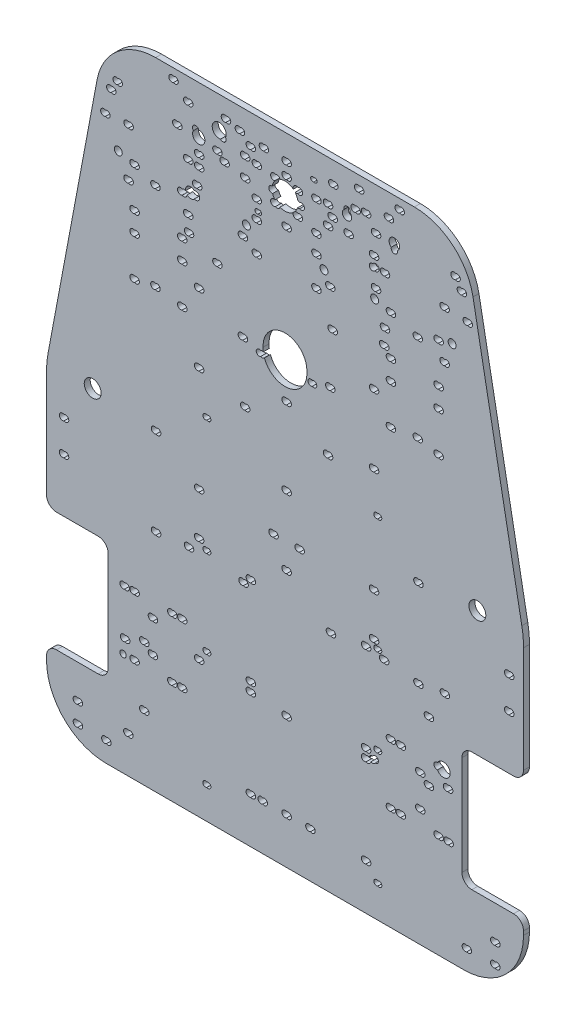
from build123d import *

# Parameters (mm, degrees)
F_3MM_DEPTH           = 3
SKETCH_2_R            = 1.6
SKETCH_2_R_2          = 4
SKETCH_2_R_3          = 1.1
SKETCH_2_R_4          = 1.35
SKETCH_2_R_5          = 4.25
SKETCH_2_R_6          = 11
SKETCH_2_R_7          = 2
SKETCH_2_R_8          = 1.5
CUT_EXTRUDE_3_DEPTH   = 201.022499011
SKETCH_741_R          = 1.6
SKETCH_741_R_2        = 1.711427977
CUT_EXTRUDE_741_DEPTH = 201.022499011
SKETCH_742_R          = 1.6
SKETCH_742_R_2        = 2.352104549
CUT_EXTRUDE_742_DEPTH = 201.022499011
SKETCH_744_R          = 1.6
SKETCH_744_R_2        = 2.649002075
CUT_EXTRUDE_744_DEPTH = 201.022499011
SKETCH_745_R          = 1.6
SKETCH_745_R_2        = 6.568410147
CUT_EXTRUDE_745_DEPTH = 201.022499011
SKETCH_746_R          = 1.6
SKETCH_746_R_2        = 1.1
SKETCH_746_R_3        = 3.518942956
SKETCH_746_R_4        = 1.35
SKETCH_746_R_5        = 3.094707093
CUT_EXTRUDE_746_DEPTH = 201.022499011
SKETCH_747_R          = 1.6
SKETCH_747_R_2        = 1.35
SKETCH_747_R_3        = 4.25
CUT_EXTRUDE_747_DEPTH = 201.022499011
SKETCH_748_R          = 4.25
SKETCH_748_R_2        = 1.6
SKETCH_748_R_3        = 3.400087717
SKETCH_748_R_4        = 1.35
CUT_EXTRUDE_748_DEPTH = 201.022499011
SKETCH_749_R          = 1.6
CUT_EXTRUDE_749_DEPTH = 201.022499011
SKETCH_750_R          = 1.6
SKETCH_750_R_2        = 11
CUT_EXTRUDE_750_DEPTH = 201.022499011
SKETCH_751_R          = 1.6
SKETCH_751_R_2        = 2.600019391
SKETCH_751_R_3        = 1.5
SKETCH_751_R_4        = 0.000364137
CUT_EXTRUDE_751_DEPTH = 201.022499011
SKETCH_752_R          = 1.6
SKETCH_752_R_2        = 1.5
CUT_EXTRUDE_752_DEPTH = 201.022499011


with BuildPart() as part:
    # 草图1 → 底盘板_3mm (new body)
    with BuildSketch(Plane.XY):
        with BuildLine():
            Line((-120, -4.645), (-120, -58.035))
            ThreePointArc((-120, -58.035), (-118.535533906, -61.570533906), (-115, -63.035))
            Line((-115, -63.035), (-94, -63.035))
            ThreePointArc((-94, -63.035), (-90.464466094, -64.499466094), (-89, -68.035))
            Line((-89, -68.035), (-89, -118.035))
            ThreePointArc((-89, -118.035), (-90.464466094, -121.570533906), (-94, -123.035))
            Line((-94, -123.035), (-115, -123.035))
            ThreePointArc((-115, -123.035), (-118.535533906, -124.499466094), (-120, -128.035))
            Line((-120, -128.035), (-120, -130))
            ThreePointArc((-120, -130), (-111.213203436, -151.213203436), (-90, -160))
            Line((-90, -160), (90, -160))
            ThreePointArc((90, -160), (111.213203436, -151.213203436), (120, -130))
            Line((120, -130), (120, -128.035))
            ThreePointArc((120, -128.035), (118.535533906, -124.499466094), (115, -123.035))
            Line((115, -123.035), (94, -123.035))
            ThreePointArc((94, -123.035), (90.464466094, -121.570533906), (89, -118.035))
            Line((89, -118.035), (89, -68.035))
            ThreePointArc((89, -68.035), (90.464466094, -64.499466094), (94, -63.035))
            Line((94, -63.035), (115, -63.035))
            ThreePointArc((115, -63.035), (118.535533906, -61.570533906), (120, -58.035))
            Line((120, -58.035), (120, -4.645))
            ThreePointArc((120, -4.645), (119.785929551, -0.020186507), (119.145, 4.565))
            Line((119.145, 4.565), (94.59, 135.53))
            ThreePointArc((94.59, 135.53), (84.261063156, 153.087014813), (65.1, 160))
            Line((65.1, 160), (-65.1, 160))
            ThreePointArc((-65.1, 160), (-84.261063156, 153.087014813), (-94.59, 135.53))
            Line((-94.59, 135.53), (-119.145, 4.565))
            ThreePointArc((-119.145, 4.565), (-119.785929551, -0.020186507), (-120, -4.645))
        make_face()
    extrude(amount=F_3MM_DEPTH)

    # 草图2 → 切除-拉伸3 (cut, through all)
    with BuildSketch(Plane.XY):
        with Locations((71.622234231, -88.447031965)):
            Circle(SKETCH_2_R)
        with Locations((71.622234231, -58.447031965)):
            Circle(SKETCH_2_R)
        with Locations((-18, -88.049953604)):
            Circle(SKETCH_2_R)
        with Locations((79.5, 99.850046396)):
            Circle(SKETCH_2_R)
        with Locations((-44, -38.557395553)):
            Circle(SKETCH_2_R)
        with Locations((-44, -91.357395553)):
            Circle(SKETCH_2_R)
        with Locations((-18, -43.549953604)):
            Circle(SKETCH_2_R)
        with Locations((-81.250002615, -100.899956178)):
            Circle(SKETCH_2_R)
        with Locations((49.5, 99.850046396)):
            Circle(SKETCH_2_R)
        with Locations((-15, 99.850051162)):
            Circle(SKETCH_2_R)
        with Locations((44, -38.557395553)):
            Circle(SKETCH_2_R)
        with Locations((-18, -137.049953604)):
            Circle(SKETCH_2_R)
        with Locations((79.622234231, -44.447031965)):
            Circle(SKETCH_2_R)
        with Locations((79.5, 123.850046396)):
            Circle(SKETCH_2_R)
        with Locations((-44, 70.442604447)):
            Circle(SKETCH_2_R)
        with Locations((-44, -17.057395553)):
            Circle(SKETCH_2_R)
        with Locations((-15, 123.850051162)):
            Circle(SKETCH_2_R)
        with Locations((44, 123.242604447)):
            Circle(SKETCH_2_R)
        with Locations((5.656854249, 137.85315184)):
            Circle(SKETCH_2_R)
        with Locations((40, -92.549953604)):
            Circle(SKETCH_2_R)
        with Locations((-18, -92.549953604)):
            Circle(SKETCH_2_R)
        with Locations((44, -17.057395553)):
            Circle(SKETCH_2_R)
        with Locations((49.5, 123.850046396)):
            Circle(SKETCH_2_R)
        with Locations((40, 145.200046396)):
            Circle(SKETCH_2_R)
        with Locations((44, -91.357395553)):
            Circle(SKETCH_2_R)
        with Locations((40, -88.049953604)):
            Circle(SKETCH_2_R)
        with Locations((-5.656854249, 137.85315184)):
            Circle(SKETCH_2_R)
        with Locations((31.2, 141.805256388)):
            Circle(SKETCH_2_R)
        with Locations((44, 35.742604447)):
            Circle(SKETCH_2_R)
        with Locations((-79.5, 99.850051162)):
            Circle(SKETCH_2_R)
        with Locations((15, 138.850046396)):
            Circle(SKETCH_2_R)
        with Locations((-6.553216354, 131.749791971)):
            Circle(SKETCH_2_R)
        with Locations((-79.622234231, -141.352878604)):
            Circle(SKETCH_2_R)
        with Locations((36.5, 153.850046396)):
            Circle(SKETCH_2_R)
        with Locations((40, -137.049953604)):
            Circle(SKETCH_2_R)
        with Locations((44, 70.442604447)):
            Circle(SKETCH_2_R)
        with Locations((-5.656854249, 126.539443341)):
            Circle(SKETCH_2_R)
        with Locations((15, 123.850046396)):
            Circle(SKETCH_2_R)
        with Locations((-18, 145.200046396)):
            Circle(SKETCH_2_R)
        with Locations((-23.5, 149.418399051)):
            Circle(SKETCH_2_R)
        with Locations((5.656854249, 126.539443341)):
            Circle(SKETCH_2_R)
        with Locations((45, 138.850046396)):
            Circle(SKETCH_2_R)
        with Locations((-79.5, 123.850051162)):
            Circle(SKETCH_2_R)
        with Locations((15, 99.850046396)):
            Circle(SKETCH_2_R)
        with Locations((40, -43.549953604)):
            Circle(SKETCH_2_R)
        with Locations((-15, 138.850046396)):
            Circle(SKETCH_2_R)
        with Locations((6.553216354, 131.749791971)):
            Circle(SKETCH_2_R)
        with Locations((-71.622234231, -127.352878604)):
            Circle(SKETCH_2_R)
        with Locations((-71.622234231, -97.352878604)):
            Circle(SKETCH_2_R)
        with Locations((55, 136.201044321)):
            Circle(SKETCH_2_R)
        with Locations((81.250001797, -84.899956178)):
            Circle(SKETCH_2_R)
        with Locations((-49.5, 148.850046396)):
            Circle(SKETCH_2_R)
        with Locations((-30.5, 150.850046396)):
            Circle(SKETCH_2_R)
        with Locations((-44, 123.242604447)):
            Circle(SKETCH_2_R)
        with Locations((15, 114.850046396)):
            Circle(SKETCH_2_R)
        with Locations((0, 132.19629759)):
            Circle(SKETCH_2_R_2)
        with Locations((-20.859650045, 130.055947635)):
            Circle(SKETCH_2_R)
        with Locations((0, 119.16118048)):
            Circle(SKETCH_2_R)
        with Locations((23.5, 149.418399051)):
            Circle(SKETCH_2_R)
        with Locations((-44, 35.742604447)):
            Circle(SKETCH_2_R)
        with Locations((31.2, 131.805756351)):
            Circle(SKETCH_2_R)
        with Locations((51.5, 148.850046396)):
            Circle(SKETCH_2_R)
        with Locations((-14, 118.569502671)):
            Circle(SKETCH_2_R_3)
        with Locations((20.859650045, 130.055947635)):
            Circle(SKETCH_2_R)
        with Locations((-34.718942956, 144.239249799)):
            Circle(SKETCH_2_R)
        with Locations((-49.5, 123.850051162)):
            Circle(SKETCH_2_R)
        with Locations((45, 114.850046396)):
            Circle(SKETCH_2_R)
        with Locations((-55, 136.201044321)):
            Circle(SKETCH_2_R)
        with Locations((-45, 114.850046396)):
            Circle(SKETCH_2_R)
        with Locations((14.001428535, 146.570931206)):
            Circle(SKETCH_2_R_3)
        with Locations((0.000714267, 147.570216938)):
            Circle(SKETCH_2_R)
        with Locations((-31.2, 141.805256388)):
            Circle(SKETCH_2_R)
        with Locations((34.718942956, 144.239249799)):
            Circle(SKETCH_2_R)
        with Locations((44, 128.742604447)):
            Circle(SKETCH_2_R)
        with Locations((-11.4, 147.950874114)):
            Circle(SKETCH_2_R)
        with Locations((-20.859650045, 139.555947635)):
            Circle(SKETCH_2_R)
        with Locations((46, -85.981658309)):
            Circle(SKETCH_2_R_4)
        with Locations((105, -140)):
            Circle(SKETCH_2_R)
        with Locations((-15, 114.850046396)):
            Circle(SKETCH_2_R)
        with Locations((-45, 138.850046396)):
            Circle(SKETCH_2_R)
        with Locations((20.859650045, 139.555947635)):
            Circle(SKETCH_2_R)
        with Locations((-31.2, 131.805756351)):
            Circle(SKETCH_2_R)
        with Locations((-40, -85.981658309)):
            Circle(SKETCH_2_R_4)
        with Locations((-85, 140)):
            Circle(SKETCH_2_R)
        with Locations((85, 140)):
            Circle(SKETCH_2_R)
        with Locations((-40, -143.981658309)):
            Circle(SKETCH_2_R_4)
        with Locations((46, 16.018341691)):
            Circle(SKETCH_2_R_4)
        with Locations((46, -143.981658309)):
            Circle(SKETCH_2_R_4)
        with Locations((-105, -140)):
            Circle(SKETCH_2_R)
        with Locations((96.780235291, 0)):
            Circle(SKETCH_2_R_5)
        with Locations((46, -41.981658309)):
            Circle(SKETCH_2_R_4)
        with Locations((-81.500257083, -78.034400889)):
            Circle(SKETCH_2_R)
        with Locations((-57.500257083, -78.034265396)):
            Circle(SKETCH_2_R)
        with Locations((52.5, -77.899953594)):
            Circle(SKETCH_2_R)
        with Locations((-76.5, -107.899953594)):
            Circle(SKETCH_2_R)
        with Locations((-40, -41.981658309)):
            Circle(SKETCH_2_R_4)
        with Locations((-52.5, -107.899953594)):
            Circle(SKETCH_2_R)
        with Locations((-81.500087717, -108.034400888)):
            Circle(SKETCH_2_R)
        with Locations((57.500087718, -108.034265395)):
            Circle(SKETCH_2_R)
        with Locations((67.250001797, -84.899956894)):
            Circle(SKETCH_2_R)
        with Locations((-96.780235291, 0)):
            Circle(SKETCH_2_R_5)
        with Locations((-52.5, -77.899953594)):
            Circle(SKETCH_2_R)
        with Locations((-76.5, -77.899953594)):
            Circle(SKETCH_2_R)
        with Locations((81.500087717, -108.034400888)):
            Circle(SKETCH_2_R)
        with Locations((67.250002615, -100.899956894)):
            Circle(SKETCH_2_R)
        with Locations((76.5, -77.899953594)):
            Circle(SKETCH_2_R)
        with Locations((81.500257083, -78.034400889)):
            Circle(SKETCH_2_R)
        with Locations((12, -137.015533447)):
            Circle(SKETCH_2_R)
        with Locations((-67.250001797, -84.899956894)):
            Circle(SKETCH_2_R)
        with Locations((-57.500087718, -108.034265395)):
            Circle(SKETCH_2_R)
        with Locations((-40, 16.018341691)):
            Circle(SKETCH_2_R_4)
        with Locations((112, -36.049427032)):
            Circle(SKETCH_2_R)
        with Locations((-90.691009521, -150)):
            Circle(SKETCH_2_R)
        with Locations((105, -150)):
            Circle(SKETCH_2_R)
        with Locations((112, -19.970226288)):
            Circle(SKETCH_2_R)
        with Locations((-67.250002615, -100.899956894)):
            Circle(SKETCH_2_R)
        with Locations((0, -137.015533447)):
            Circle(SKETCH_2_R)
        with Locations((-105, -150)):
            Circle(SKETCH_2_R)
        with Locations((91.157012939, 123.126899719)):
            Circle(SKETCH_2_R)
        with Locations((-112, -36.049427032)):
            Circle(SKETCH_2_R)
        with Locations((22, 60.203447413)):
            Circle(SKETCH_2_R)
        with Locations((76.5, -107.899953594)):
            Circle(SKETCH_2_R)
        with Locations((23.201995778, 134.920523381)):
            Circle(SKETCH_2_R)
        with Locations((-112, -19.970226288)):
            Circle(SKETCH_2_R)
        with Locations((56.9, 155)):
            Circle(SKETCH_2_R)
        with Locations((-91.157012939, 123.126899719)):
            Circle(SKETCH_2_R)
        with Locations((66.328412861, -46.618020535)):
            Circle(SKETCH_2_R)
        with Locations((90.691009521, -150)):
            Circle(SKETCH_2_R)
        with Locations((-65.671587139, -46.618020535)):
            Circle(SKETCH_2_R)
        with Locations((-66, 60.203447413)):
            Circle(SKETCH_2_R)
        with Locations((-56.9, 155)):
            Circle(SKETCH_2_R)
        with Locations((88.2, 134.984603882)):
            Circle(SKETCH_2_R)
        with Locations((-22, 60.203447413)):
            Circle(SKETCH_2_R)
        with Locations((66.328412861, -2.618020535)):
            Circle(SKETCH_2_R)
        with Locations((57.500257083, -78.034265396)):
            Circle(SKETCH_2_R)
        with Locations((23.201995778, 85.920523381)):
            Circle(SKETCH_2_R)
        with Locations((-88.2, 134.984603882)):
            Circle(SKETCH_2_R)
        with Locations((22, 104.203447413)):
            Circle(SKETCH_2_R)
        with Locations((52.5, 108.100046406)):
            Circle(SKETCH_2_R)
        with Locations((76.5, 58.100046406)):
            Circle(SKETCH_2_R)
        with Locations((-66, 104.203447413)):
            Circle(SKETCH_2_R)
        with Locations((66, 60.203447413)):
            Circle(SKETCH_2_R)
        with Locations((-76.5, 108.100046406)):
            Circle(SKETCH_2_R)
        with Locations((52.5, 78.100046406)):
            Circle(SKETCH_2_R)
        with Locations((76.5, 78.100046406)):
            Circle(SKETCH_2_R)
        with Locations((-12, -137.015533447)):
            Circle(SKETCH_2_R)
        with Locations((-76.5, 88.100046406)):
            Circle(SKETCH_2_R)
        with Locations((76.5, 88.100046406)):
            Circle(SKETCH_2_R)
        with Locations((-76.5, 58.100046406)):
            Circle(SKETCH_2_R)
        with Locations((-34.798004222, 85.920523381)):
            Circle(SKETCH_2_R)
        with Locations((52.5, -107.899953594)):
            Circle(SKETCH_2_R)
        with Locations((76.5, 108.100046406)):
            Circle(SKETCH_2_R)
        with Locations((-52.5, 88.100046406)):
            Circle(SKETCH_2_R)
        with Locations((49.100000001, 92.072292328)):
            Circle(SKETCH_2_R)
        with Locations((-52.5, 58.100046406)):
            Circle(SKETCH_2_R)
        with Locations((-65.671587139, -2.618020535)):
            Circle(SKETCH_2_R)
        with Locations((-52.5, 78.100046406)):
            Circle(SKETCH_2_R)
        with Locations((0, 61.572292328)):
            Circle(SKETCH_2_R_6)
        with Locations((66, 104.203447413)):
            Circle(SKETCH_2_R)
        with Locations((-52.5, 108.100046406)):
            Circle(SKETCH_2_R)
        with Locations((-83.899680603, 109.91658817)):
            Circle(SKETCH_2_R_7)
        with Locations((-76.5, 78.100046406)):
            Circle(SKETCH_2_R)
        with Locations((-49.100000003, 92.072292326)):
            Circle(SKETCH_2_R)
        with Locations((-20.859650045, 30.236647545)):
            Circle(SKETCH_2_R)
        with Locations((6.553216354, -17.950208029)):
            Circle(SKETCH_2_R)
        with Locations((52.5, 88.100046406)):
            Circle(SKETCH_2_R)
        with Locations((-22, 104.203447413)):
            Circle(SKETCH_2_R)
        with Locations((-44.899980612, 109.916808344)):
            Circle(SKETCH_2_R_7)
        with Locations((1e-09, -94.027707672)):
            Circle(SKETCH_2_R)
        with Locations((-34.798004222, 134.920523381)):
            Circle(SKETCH_2_R)
        with Locations((12.991095324, 57.47014817)):
            Circle(SKETCH_2_R_8)
        with Locations((19.600159387, 109.917172481)):
            Circle(SKETCH_2_R_7)
        with Locations((20.859650045, 30.236647545)):
            Circle(SKETCH_2_R)
        with Locations((-6.553216354, -17.950208029)):
            Circle(SKETCH_2_R)
        with Locations((-3e-09, 4.172292326)):
            Circle(SKETCH_2_R)
        with Locations((1e-09, 42.972292328)):
            Circle(SKETCH_2_R)
        with Locations((0, -30.53881952)):
            Circle(SKETCH_2_R)
        with Locations((-44, 128.742604447)):
            Circle(SKETCH_2_R)
        with Locations((-49.5, 99.850051162)):
            Circle(SKETCH_2_R)
        with Locations((-21.671587139, -46.618020535)):
            Circle(SKETCH_2_R)
        with Locations((-3e-09, 141.172292326)):
            Circle(SKETCH_2_R)
        with Locations((-49.100000003, -44.927707674)):
            Circle(SKETCH_2_R)
        with Locations((52.5, 58.100046406)):
            Circle(SKETCH_2_R)
        with Locations((45.100239394, 109.917316443)):
            Circle(SKETCH_2_R_7)
        with Locations((-12.989666789, 57.470216938)):
            Circle(SKETCH_2_R_8)
        with Locations((84.099939386, 109.917536617)):
            Circle(SKETCH_2_R_7)
        with Locations((22.328412861, -46.618020535)):
            Circle(SKETCH_2_R)
        with Locations((49.100000001, -44.927707672)):
            Circle(SKETCH_2_R)
        with Locations((-19.399540604, 109.916952308)):
            Circle(SKETCH_2_R_7)
    extrude(amount=CUT_EXTRUDE_3_DEPTH, mode=Mode.SUBTRACT)

    # 草图741 → 切除-拉伸741 (cut, through all)
    with BuildSketch(Plane.XY):
        with Locations((73.222234231, -88.447031965)):
            Circle(SKETCH_741_R)
        with Locations((73.222234231, -58.447031965)):
            Circle(SKETCH_741_R)
        with Locations((-16.4, -88.049953604)):
            Circle(SKETCH_741_R)
        with Locations((81.1, 99.850046396)):
            Circle(SKETCH_741_R)
        with Locations((-42.4, -38.557395553)):
            Circle(SKETCH_741_R)
        with Locations((-42.4, -91.357395553)):
            Circle(SKETCH_741_R)
        with Locations((-16.4, -43.549953604)):
            Circle(SKETCH_741_R)
        with Locations((-79.650002615, -100.899956178)):
            Circle(SKETCH_741_R)
        with Locations((51.1, 99.850046396)):
            Circle(SKETCH_741_R)
        with Locations((-13.4, 99.850051162)):
            Circle(SKETCH_741_R)
        with Locations((45.6, -38.557395553)):
            Circle(SKETCH_741_R)
        with Locations((-16.4, -137.049953604)):
            Circle(SKETCH_741_R)
        with Locations((81.222234231, -44.447031965)):
            Circle(SKETCH_741_R)
        with Locations((81.1, 123.850046396)):
            Circle(SKETCH_741_R)
        with Locations((-42.4, 70.442604447)):
            Circle(SKETCH_741_R)
        with Locations((-42.4, -17.057395553)):
            Circle(SKETCH_741_R)
        with Locations((-13.4, 123.850051162)):
            Circle(SKETCH_741_R)
        with Locations((45.6, 123.850046396)):
            Circle(SKETCH_741_R_2)
        with Locations((7.256854249, 137.85315184)):
            Circle(SKETCH_741_R)
        with Locations((41.6, -92.549953604)):
            Circle(SKETCH_741_R)
    extrude(amount=CUT_EXTRUDE_741_DEPTH, mode=Mode.SUBTRACT)

    # 草图742 → 切除-拉伸742 (cut, through all)
    with BuildSketch(Plane.XY):
        with Locations((-16.4, -92.549953604)):
            Circle(SKETCH_742_R)
        with Locations((45.6, -17.057395553)):
            Circle(SKETCH_742_R)
        with Locations((51.1, 123.850046396)):
            Circle(SKETCH_742_R)
        with Locations((41.6, 145.200046396)):
            Circle(SKETCH_742_R)
        with Locations((45.432856299, -90.645410422)):
            Circle(SKETCH_742_R)
        with Locations((41.6, -88.049953604)):
            Circle(SKETCH_742_R)
        with Locations((-4.056854249, 137.85315184)):
            Circle(SKETCH_742_R)
        with Locations((31.2, 139.45315184)):
            Circle(SKETCH_742_R_2)
        with Locations((45.6, 35.742604447)):
            Circle(SKETCH_742_R)
        with Locations((-77.9, 99.850051162)):
            Circle(SKETCH_742_R)
        with Locations((16.6, 138.850046396)):
            Circle(SKETCH_742_R)
        with Locations((-4.953216354, 131.749791971)):
            Circle(SKETCH_742_R)
        with Locations((-78.022234231, -141.352878604)):
            Circle(SKETCH_742_R)
        with Locations((38.1, 153.850046396)):
            Circle(SKETCH_742_R)
        with Locations((41.6, -137.049953604)):
            Circle(SKETCH_742_R)
        with Locations((45.6, 70.442604447)):
            Circle(SKETCH_742_R)
        with Locations((-4.056854249, 126.539443341)):
            Circle(SKETCH_742_R)
        with Locations((16.6, 123.850046396)):
            Circle(SKETCH_742_R)
        with Locations((-16.4, 145.200046396)):
            Circle(SKETCH_742_R)
        with Locations((-21.9, 149.418399051)):
            Circle(SKETCH_742_R)
    extrude(amount=CUT_EXTRUDE_742_DEPTH, mode=Mode.SUBTRACT)

    # 草图744 → 切除-拉伸744 (cut, through all)
    with BuildSketch(Plane.XY):
        with Locations((7.256854249, 126.539443341)):
            Circle(SKETCH_744_R)
        with Locations((46.6, 138.850046396)):
            Circle(SKETCH_744_R)
        with Locations((-77.9, 123.850051162)):
            Circle(SKETCH_744_R)
        with Locations((16.6, 99.850046396)):
            Circle(SKETCH_744_R)
        with Locations((41.6, -43.549953604)):
            Circle(SKETCH_744_R)
        with Locations((-13.4, 138.850046396)):
            Circle(SKETCH_744_R)
        with Locations((8.153216354, 131.749791971)):
            Circle(SKETCH_744_R)
        with Locations((-70.022234231, -127.352878604)):
            Circle(SKETCH_744_R)
        with Locations((-70.022234231, -97.352878604)):
            Circle(SKETCH_744_R)
        with Locations((55, 138.850046396)):
            Circle(SKETCH_744_R_2)
    extrude(amount=CUT_EXTRUDE_744_DEPTH, mode=Mode.SUBTRACT)

    # 草图745 → 切除-拉伸745 (cut, through all)
    with BuildSketch(Plane.XY):
        with Locations((82.850001797, -84.899956178)):
            Circle(SKETCH_745_R)
        with Locations((-47.9, 148.850046396)):
            Circle(SKETCH_745_R)
        with Locations((-28.9, 150.850046396)):
            Circle(SKETCH_745_R)
        with Locations((-42.4, 123.242604447)):
            Circle(SKETCH_745_R)
        with Locations((16.6, 114.850046396)):
            Circle(SKETCH_745_R)
        with Locations((0, 132.19629759)):
            Circle(SKETCH_745_R_2)
        with Locations((-19.259650045, 130.055947635)):
            Circle(SKETCH_745_R)
        with Locations((1.6, 119.16118048)):
            Circle(SKETCH_745_R)
        with Locations((25.1, 149.418399051)):
            Circle(SKETCH_745_R)
        with Locations((-42.4, 35.742604447)):
            Circle(SKETCH_745_R)
    extrude(amount=CUT_EXTRUDE_745_DEPTH, mode=Mode.SUBTRACT)

    # 草图746 → 切除-拉伸746 (cut, through all)
    # profile 1 of 19: a face of its own
    with BuildSketch(Plane.XY):
        with Locations((32.8, 131.805756351)):
            Circle(SKETCH_746_R)
    # profile 2 of 19: a face of its own
    with BuildSketch(Plane.XY):
        with Locations((53.1, 148.850046396)):
            Circle(SKETCH_746_R)
    # profile 3 of 19: a face of its own
    with BuildSketch(Plane.XY):
        with Locations((-12.9, 118.569502671)):
            Circle(SKETCH_746_R_2)
    # profile 4 of 19: a face of its own
    with BuildSketch(Plane.XY):
        with Locations((22.459650045, 130.055947635)):
            Circle(SKETCH_746_R)
    # profile 5 of 19: a face of its own
    with BuildSketch(Plane.XY):
        with Locations((-47.9, 123.850051162)):
            Circle(SKETCH_746_R)
    # profile 6 of 19: a face of its own
    with BuildSketch(Plane.XY):
        with Locations((46.6, 114.850046396)):
            Circle(SKETCH_746_R)
    # profile 7 of 19: a face of its own
    with BuildSketch(Plane.XY):
        with Locations((-53.4, 136.201044321)):
            Circle(SKETCH_746_R)
    # profile 8 of 19: a face of its own
    with BuildSketch(Plane.XY):
        with Locations((-43.4, 114.850046396)):
            Circle(SKETCH_746_R)
    # profile 9 of 19: a face of its own
    with BuildSketch(Plane.XY):
        with Locations((15.101428535, 146.570931206)):
            Circle(SKETCH_746_R_2)
    # profile 10 of 19: a face of its own
    with BuildSketch(Plane.XY):
        with Locations((1.600714268, 147.570216938)):
            Circle(SKETCH_746_R)
    # profile 11 of 19: a face of its own
    with BuildSketch(Plane.XY):
        with Locations((-33.118942956, 144.239249799)):
            Circle(SKETCH_746_R_3)
        with Locations((-33.118942956, 144.239249799)):
            Circle(SKETCH_746_R, mode=Mode.SUBTRACT)
    # profile 12 of 19: a face of its own
    with BuildSketch(Plane.XY):
        with Locations((36.318942956, 144.239249799)):
            Circle(SKETCH_746_R)
    # profile 13 of 19: a face of its own
    with BuildSketch(Plane.XY):
        with Locations((45.6, 128.742604447)):
            Circle(SKETCH_746_R)
    # profile 14 of 19: a face of its own
    with BuildSketch(Plane.XY):
        with Locations((-9.8, 147.950874114)):
            Circle(SKETCH_746_R)
    # profile 15 of 19: a face of its own
    with BuildSketch(Plane.XY):
        with Locations((-19.259650045, 139.555947635)):
            Circle(SKETCH_746_R)
    # profile 16 of 19: a face of its own
    with BuildSketch(Plane.XY):
        with Locations((47.35, -85.981658309)):
            Circle(SKETCH_746_R_4)
    # profile 17 of 19: a face of its own
    with BuildSketch(Plane.XY):
        with Locations((106.6, -140)):
            Circle(SKETCH_746_R)
    # profile 18 of 19: a face of its own
    with BuildSketch(Plane.XY):
        with Locations((-13.4, 114.850046396)):
            Circle(SKETCH_746_R)
    # profile 19 of 19: a face of its own
    with BuildSketch(Plane.XY):
        with Locations((-43.4, 136.201044321)):
            Circle(SKETCH_746_R_5)
    extrude(amount=CUT_EXTRUDE_746_DEPTH, mode=Mode.SUBTRACT)


with BuildPart() as cut_extrude_746_piece_1:
    # of the separate pieces the step leaves, piece 1, a body of its own (cut_extrude_746_pieces)
    add(part.part.solids().sort_by_distance((-120, -4.645, 0))[0])

    # 草图747 → 切除-拉伸747 (cut, through all)
    with BuildSketch(Plane.XY):
        with Locations((22.459650045, 139.555947635)):
            Circle(SKETCH_747_R)
        with Locations((-29.6, 131.805756351)):
            Circle(SKETCH_747_R)
        with Locations((-38.65, -85.981658309)):
            Circle(SKETCH_747_R_2)
        with Locations((-83.4, 140)):
            Circle(SKETCH_747_R)
        with Locations((86.6, 140)):
            Circle(SKETCH_747_R)
        with Locations((-38.65, -143.981658309)):
            Circle(SKETCH_747_R_2)
        with Locations((47.35, 16.018341691)):
            Circle(SKETCH_747_R_2)
        with Locations((47.35, -143.981658309)):
            Circle(SKETCH_747_R_2)
        with Locations((-103.4, -140)):
            Circle(SKETCH_747_R)
        with Locations((96.780235291, 0)):
            Circle(SKETCH_747_R_3)
        with Locations((47.35, -41.981658309)):
            Circle(SKETCH_747_R_2)
        with Locations((-79.900257083, -78.034400889)):
            Circle(SKETCH_747_R)
        with Locations((-55.900257083, -78.034265396)):
            Circle(SKETCH_747_R)
        with Locations((54.1, -77.899953594)):
            Circle(SKETCH_747_R)
        with Locations((-74.9, -107.899953594)):
            Circle(SKETCH_747_R)
        with Locations((-38.65, -41.981658309)):
            Circle(SKETCH_747_R_2)
        with Locations((-50.9, -107.899953594)):
            Circle(SKETCH_747_R)
        with Locations((59.100087718, -108.034265395)):
            Circle(SKETCH_747_R)
        with Locations((68.850001797, -84.899956894)):
            Circle(SKETCH_747_R)
    extrude(amount=CUT_EXTRUDE_747_DEPTH, mode=Mode.SUBTRACT)

    # 草图748 → 切除-拉伸748 (cut, through all)
    # profile 1 of 19: a face of its own
    with BuildSketch(Plane.XY):
        with Locations((-96.780235291, 0)):
            Circle(SKETCH_748_R)
    # profile 2 of 19: a face of its own
    with BuildSketch(Plane.XY):
        with Locations((-50.9, -77.899953594)):
            Circle(SKETCH_748_R_2)
    # profile 3 of 19: a face of its own
    with BuildSketch(Plane.XY):
        with Locations((-74.9, -77.899953594)):
            Circle(SKETCH_748_R_2)
    # profile 4 of 19: a face of its own
    with BuildSketch(Plane.XY):
        with Locations((83.100087717, -108.034400888)):
            Circle(SKETCH_748_R_2)
    # profile 5 of 19: a face of its own
    with BuildSketch(Plane.XY):
        with Locations((68.850002615, -100.899956894)):
            Circle(SKETCH_748_R_2)
    # profile 6 of 19: a face of its own
    with BuildSketch(Plane.XY):
        with Locations((79.7, -77.899953594)):
            Circle(SKETCH_748_R_3)
        with Locations((78.1, -77.899953594)):
            Circle(SKETCH_748_R_2, mode=Mode.SUBTRACT)
    # profile 7 of 19: a face of its own
    with BuildSketch(Plane.XY):
        with Locations((13.6, -137.015533447)):
            Circle(SKETCH_748_R_2)
    # profile 8 of 19: a face of its own
    with BuildSketch(Plane.XY):
        with Locations((-65.650001797, -84.899956894)):
            Circle(SKETCH_748_R_2)
    # profile 9 of 19: a face of its own
    with BuildSketch(Plane.XY):
        with Locations((-55.900087718, -108.034265395)):
            Circle(SKETCH_748_R_2)
    # profile 10 of 19: a face of its own
    with BuildSketch(Plane.XY):
        with Locations((-38.65, 16.018341691)):
            Circle(SKETCH_748_R_4)
    # profile 11 of 19: a face of its own
    with BuildSketch(Plane.XY):
        with Locations((113.6, -36.049427032)):
            Circle(SKETCH_748_R_2)
    # profile 12 of 19: a face of its own
    with BuildSketch(Plane.XY):
        with Locations((-89.091009521, -150)):
            Circle(SKETCH_748_R_2)
    # profile 13 of 19: a face of its own
    with BuildSketch(Plane.XY):
        with Locations((106.6, -150)):
            Circle(SKETCH_748_R_2)
    # profile 14 of 19: a face of its own
    with BuildSketch(Plane.XY):
        with Locations((113.6, -19.970226288)):
            Circle(SKETCH_748_R_2)
    # profile 15 of 19: a face of its own
    with BuildSketch(Plane.XY):
        with Locations((-65.650002615, -100.899956894)):
            Circle(SKETCH_748_R_2)
    # profile 16 of 19: a face of its own
    with BuildSketch(Plane.XY):
        with Locations((1.6, -137.015533447)):
            Circle(SKETCH_748_R_2)
    # profile 17 of 19: a face of its own
    with BuildSketch(Plane.XY):
        with Locations((-103.4, -150)):
            Circle(SKETCH_748_R_2)
    # profile 18 of 19: a face of its own
    with BuildSketch(Plane.XY):
        with Locations((92.757012939, 123.126899719)):
            Circle(SKETCH_748_R_2)
    # profile 19 of 19: a face of its own
    with BuildSketch(Plane.XY):
        with Locations((-110.4, -36.049427032)):
            Circle(SKETCH_748_R_2)
    extrude(amount=CUT_EXTRUDE_748_DEPTH, mode=Mode.SUBTRACT)


with BuildPart() as cut_extrude_746_piece_2:
    # of the separate pieces the step leaves, piece 2, a body of its own (cut_extrude_746_pieces)
    add(part.part.solids().sort_by_distance((-31.846993468, 143.268608517, 0))[0])


with BuildPart() as cut_extrude_748_piece_1:
    # of the separate pieces the step leaves, piece 1, a body of its own (cut_extrude_748_pieces)
    add(cut_extrude_746_piece_1.part.solids().sort_by_distance((-120, -4.645, 0))[0])

    # 草图749 → 切除-拉伸749 (cut, through all)
    with BuildSketch(Plane.XY):
        with Locations((23.6, 60.203447413)):
            Circle(SKETCH_749_R)
        with Locations((78.1, -107.899953594)):
            Circle(SKETCH_749_R)
        with Locations((24.801995778, 134.920523381)):
            Circle(SKETCH_749_R)
        with Locations((-110.4, -19.970226288)):
            Circle(SKETCH_749_R)
        with Locations((58.5, 155)):
            Circle(SKETCH_749_R)
        with Locations((-89.557012939, 123.126899719)):
            Circle(SKETCH_749_R)
        with Locations((67.928412861, -46.618020535)):
            Circle(SKETCH_749_R)
        with Locations((92.291009521, -150)):
            Circle(SKETCH_749_R)
        with Locations((-64.071587139, -46.618020535)):
            Circle(SKETCH_749_R)
        with Locations((-64.4, 60.203447413)):
            Circle(SKETCH_749_R)
        with Locations((-55.3, 155)):
            Circle(SKETCH_749_R)
        with Locations((89.8, 134.984603882)):
            Circle(SKETCH_749_R)
        with Locations((-20.4, 60.203447413)):
            Circle(SKETCH_749_R)
        with Locations((67.928412861, -2.618020535)):
            Circle(SKETCH_749_R)
        with Locations((59.100257083, -78.034265396)):
            Circle(SKETCH_749_R)
        with Locations((24.801995778, 85.920523381)):
            Circle(SKETCH_749_R)
        with Locations((-86.6, 134.984603882)):
            Circle(SKETCH_749_R)
        with Locations((23.6, 104.203447413)):
            Circle(SKETCH_749_R)
        with Locations((54.1, 108.100046406)):
            Circle(SKETCH_749_R)
        with Locations((78.1, 58.100046406)):
            Circle(SKETCH_749_R)
    extrude(amount=CUT_EXTRUDE_749_DEPTH, mode=Mode.SUBTRACT)

    # 草图750 → 切除-拉伸750 (cut, through all)
    with BuildSketch(Plane.XY):
        with Locations((-64.4, 104.203447413)):
            Circle(SKETCH_750_R)
        with Locations((67.6, 60.203447413)):
            Circle(SKETCH_750_R)
        with Locations((-74.9, 108.100046406)):
            Circle(SKETCH_750_R)
        with Locations((54.1, 78.100046406)):
            Circle(SKETCH_750_R)
        with Locations((78.1, 78.100046406)):
            Circle(SKETCH_750_R)
        with Locations((-10.4, -137.015533447)):
            Circle(SKETCH_750_R)
        with Locations((-74.9, 88.100046406)):
            Circle(SKETCH_750_R)
        with Locations((78.1, 88.100046406)):
            Circle(SKETCH_750_R)
        with Locations((-74.9, 58.100046406)):
            Circle(SKETCH_750_R)
        with Locations((-33.198004222, 85.920523381)):
            Circle(SKETCH_750_R)
        with Locations((54.1, -107.899953594)):
            Circle(SKETCH_750_R)
        with Locations((78.1, 108.100046406)):
            Circle(SKETCH_750_R)
        with Locations((-50.9, 88.100046406)):
            Circle(SKETCH_750_R)
        with Locations((50.700000001, 92.072292328)):
            Circle(SKETCH_750_R)
        with Locations((-50.9, 58.100046406)):
            Circle(SKETCH_750_R)
        with Locations((-64.071587139, -2.618020535)):
            Circle(SKETCH_750_R)
        with Locations((-50.9, 78.100046406)):
            Circle(SKETCH_750_R)
        with Locations((0, 60.203447413)):
            Circle(SKETCH_750_R_2)
        with Locations((67.6, 104.203447413)):
            Circle(SKETCH_750_R)
        with Locations((-50.9, 108.100046406)):
            Circle(SKETCH_750_R)
    extrude(amount=CUT_EXTRUDE_750_DEPTH, mode=Mode.SUBTRACT)

    # 草图751 → 切除-拉伸751 (cut, through all)
    with BuildSketch(Plane.XY):
        with Locations((-74.9, 78.100046406)):
            Circle(SKETCH_751_R)
        with Locations((-47.500000003, 92.072292326)):
            Circle(SKETCH_751_R)
        with Locations((-19.259650045, 30.236647545)):
            Circle(SKETCH_751_R)
        with Locations((8.153216354, -17.950208029)):
            Circle(SKETCH_751_R)
        with Locations((54.1, 88.100046406)):
            Circle(SKETCH_751_R)
        with Locations((-20.4, 104.203447413)):
            Circle(SKETCH_751_R)
        with Locations((-47.500000003, 109.916808344)):
            Circle(SKETCH_751_R_2)
        with Locations((1.600000001, -94.027707672)):
            Circle(SKETCH_751_R)
        with Locations((-33.198004222, 134.920523381)):
            Circle(SKETCH_751_R)
        with Locations((14.491095324, 57.47014817)):
            Circle(SKETCH_751_R_3)
        with Locations((19.600159387, 109.916808344)):
            Circle(SKETCH_751_R_4)
        with Locations((22.459650045, 30.236647545)):
            Circle(SKETCH_751_R)
        with Locations((-4.953216354, -17.950208029)):
            Circle(SKETCH_751_R)
        with Locations((1.599999997, 4.172292326)):
            Circle(SKETCH_751_R)
        with Locations((1.600000001, 42.972292328)):
            Circle(SKETCH_751_R)
        with Locations((1.6, -30.53881952)):
            Circle(SKETCH_751_R)
        with Locations((-42.4, 128.742604447)):
            Circle(SKETCH_751_R)
        with Locations((-47.9, 99.850051162)):
            Circle(SKETCH_751_R)
        with Locations((-20.071587139, -46.618020535)):
            Circle(SKETCH_751_R)
    extrude(amount=CUT_EXTRUDE_751_DEPTH, mode=Mode.SUBTRACT)

    # 草图752 → 切除-拉伸752 (cut, through all)
    with BuildSketch(Plane.XY):
        with Locations((1.599999997, 141.172292326)):
            Circle(SKETCH_752_R)
        with Locations((-47.500000003, -44.927707674)):
            Circle(SKETCH_752_R)
        with Locations((54.1, 58.100046406)):
            Circle(SKETCH_752_R)
        with Locations((-11.489666789, 57.470216938)):
            Circle(SKETCH_752_R_2)
        with Locations((23.928412861, -46.618020535)):
            Circle(SKETCH_752_R)
        with Locations((50.700000001, -44.927707672)):
            Circle(SKETCH_752_R)
    extrude(amount=CUT_EXTRUDE_752_DEPTH, mode=Mode.SUBTRACT)


with BuildPart() as cut_extrude_748_piece_2:
    # of the separate pieces the step leaves, piece 2, a body of its own (cut_extrude_748_pieces)
    add(cut_extrude_746_piece_1.part.solids().sort_by_distance((77.3, -76.514312948, 0))[0])


solid = cut_extrude_748_piece_1.part
